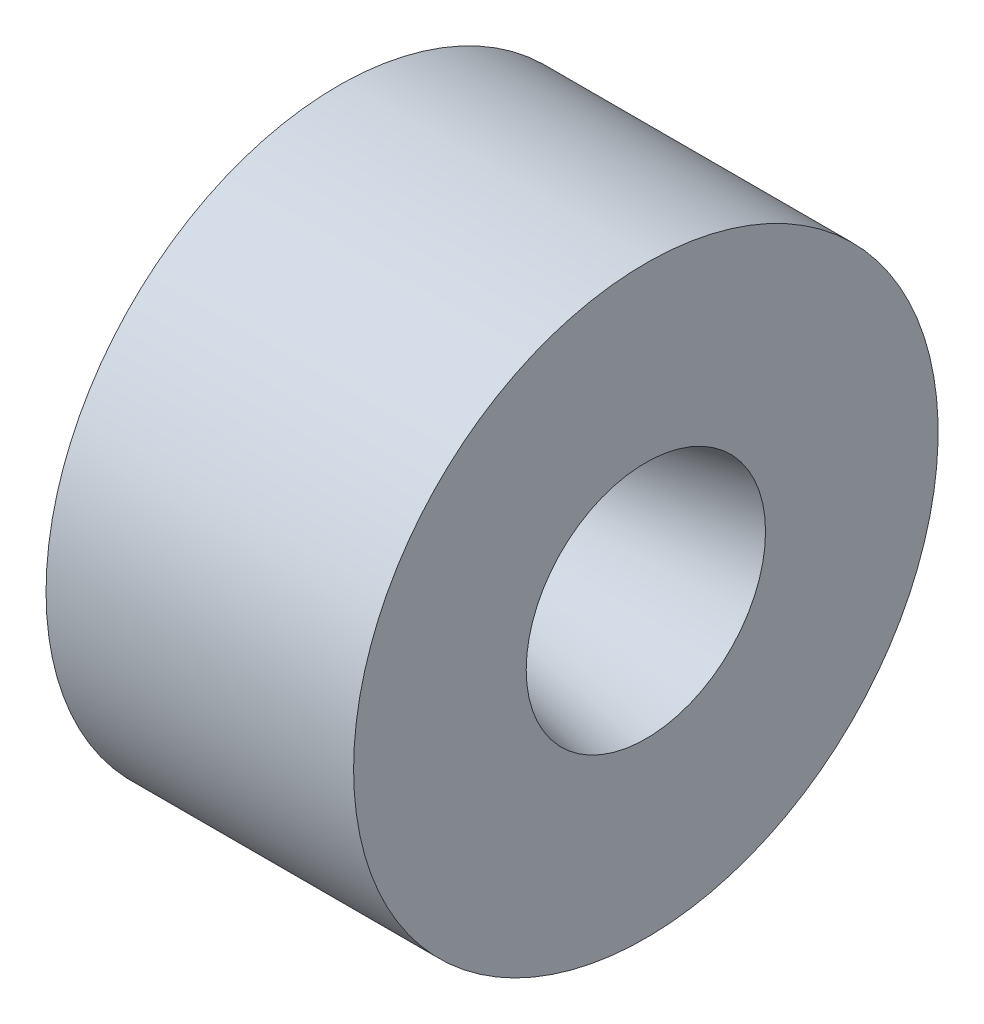
from build123d import *

# Parameters (mm, degrees)
M8_CLEARANCE_HOLE1_D = 10


with BuildPart() as part:
    # Sketch1 → Revolve1 (revolve)
    with BuildSketch(Plane.XY):
        Polygon((0, -139.7), (-73.5, -139.7), (-73.5, -57.2), (-13.5, -41.25), (-13.5, -20), (-5.499, -20), (-5.499, -41.25), (73.5, -57.2), (73.5, -139.7), align=None)
    revolve(axis=Axis((-62.857142857, 0, 0), (1, 0, 0)))

    # M8 Clearance Hole1 (through all)
    with Locations(Plane.ZY.offset(13.5)):
        with Locations((25.11473671, 14.5), (0, -29), (-25.11473671, 14.5)):
            Hole(M8_CLEARANCE_HOLE1_D / 2)


solid = part.part
